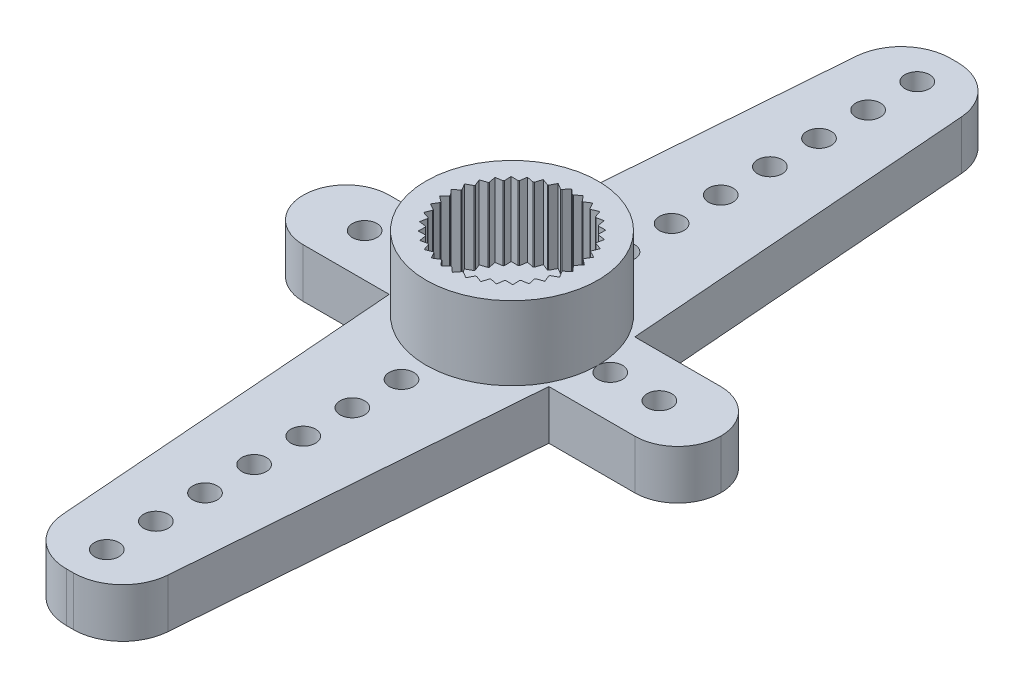
from build123d import *

# Parameters (mm, degrees)
BOSS_EXTRUDE1_DEPTH     = 2
FILLET1_R               = 2
FILLET2_R               = 1.75
SKETCH2_R               = 3.5
BOSS_EXTRUDE2_DEPTH     = 3
SKETCH3_R               = 2.5
CUT_EXTRUDE1_DEPTH      = 1
SKETCH4_R               = 1
CUT_EXTRUDE2_DEPTH      = 21.303940504
CUT_EXTRUDE3_START      = -3
SKETCH5_R               = 2.5
CUT_EXTRUDE3_DEPTH      = 3
CUT_EXTRUDE4_DEPTH      = 3
CIRPATTERN1_COUNT       = 36
SKETCH9_R               = 0.5
CUT_EXTRUDE5_DEPTH      = 21.524375752
LPATTERN1_COUNT         = 7
LPATTERN1_PITCH         = 2
MIRROR1_COPY_1_SKETCH_R = 0.5
MIRROR1_COPY_1_DEPTH    = 21.524375752
MIRROR1_COPY_2_SKETCH_R = 0.5
MIRROR1_COPY_2_DEPTH    = 21.524375752
MIRROR1_COPY_3_SKETCH_R = 0.5
MIRROR1_COPY_3_DEPTH    = 21.524375752
MIRROR1_COPY_4_SKETCH_R = 0.5
MIRROR1_COPY_4_DEPTH    = 21.524375752
MIRROR1_COPY_5_SKETCH_R = 0.5
MIRROR1_COPY_5_DEPTH    = 21.524375752
MIRROR1_COPY_6_SKETCH_R = 0.5
MIRROR1_COPY_6_DEPTH    = 21.524375752
SKETCH11_R              = 0.5
CUT_EXTRUDE6_DEPTH      = 21.524375752
LPATTERN2_COUNT         = 2
LPATTERN2_PITCH         = 2
MIRROR2_COPY_1_SKETCH_R = 0.5
MIRROR2_COPY_1_DEPTH    = 21.524375752


with BuildPart() as part:
    # Sketch1 → Boss-Extrude1 (new body)
    with BuildSketch(Plane(origin=(0, 0, 0), x_dir=(1, 0, 0), z_dir=(0, 1, 0))):
        Polygon((-8.5, 1.75), (-3.25, 1.75), (-2, 18), (2, 18), (3.25, 1.75), (8.5, 1.75), (8.5, -1.75), (3.25, -1.75), (2, -18), (-2, -18), (-3.25, -1.75), (-8.5, -1.75), align=None)
    extrude(amount=BOSS_EXTRUDE1_DEPTH)

    # Fillet1
    fillet1_edges = [part.edges().sort_by_distance(p)[0] for p in [
        (-2, 1, -18),
        (2, 1, -18),
        (2, 1, 18),
        (-2, 1, 18),
    ]]
    fillet(fillet1_edges, radius=FILLET1_R)

    # Fillet2
    fillet2_edges = [part.edges().sort_by_distance(p)[0] for p in [
        (-8.5, 1, -1.75),
        (-8.5, 1, 1.75),
        (8.5, 1, -1.75),
        (8.5, 1, 1.75),
    ]]
    fillet(fillet2_edges, radius=FILLET2_R - 0.0001)  # a hair under: the kernel refuses the full size

    # Sketch2 → Boss-Extrude2 (add)
    with BuildSketch(Plane(origin=(0, 2, 0), x_dir=(1, 0, 0), z_dir=(0, 1, 0))):
        with Locations(Location((0, 0, 0), (0, 0, 90))):
            Circle(SKETCH2_R)
    extrude(amount=BOSS_EXTRUDE2_DEPTH)

    # Sketch3 → Cut-Extrude1 (cut)
    with BuildSketch(Plane(origin=(0, 0, 0), x_dir=(-1, 0, 0), z_dir=(0, -1, 0))):
        with Locations(Location((0, 0, 0), (0, 0, 90))):
            Circle(SKETCH3_R)
    extrude(amount=-CUT_EXTRUDE1_DEPTH, mode=Mode.SUBTRACT)

    # Sketch4 → Cut-Extrude2 (cut, through all)
    with BuildSketch(Plane(origin=(0, 1, 0), x_dir=(-1, 0, 0), z_dir=(0, -1, 0))):
        with Locations(Location((0, 0, 0), (0, 0, 90))):
            Circle(SKETCH4_R)
    extrude(amount=-CUT_EXTRUDE2_DEPTH, mode=Mode.SUBTRACT)

    # Sketch5 → Cut-Extrude3 (cut)
    with BuildSketch(Plane(origin=(0, 5, 0), x_dir=(1, 0, 0), z_dir=(0, 1, 0)).offset(CUT_EXTRUDE3_START)):
        with Locations(Location((0, 0, 0), (0, 0, 90))):
            Circle(SKETCH5_R)
    extrude(amount=CUT_EXTRUDE3_DEPTH, mode=Mode.SUBTRACT)

    # Sketch6 → Cut-Extrude4 (cut)
    with BuildSketch(Plane(origin=(0, 5, 0), x_dir=(1, 0, 0), z_dir=(0, 1, 0))):
        Polygon((-2.5, 0), (-2.691676801, 0.211839558), (-2.469220851, 0.391086163), align=None)
    cut_extrude4 = extrude(amount=-CUT_EXTRUDE4_DEPTH, mode=Mode.SUBTRACT)

    # CirPattern1: Cut-Extrude4 ×36 about axis
    cirpattern1_axis = Axis((0, 0, 0), (0, 1, 0))
    for i in range(1, CIRPATTERN1_COUNT):
        add(cut_extrude4.rotate(cirpattern1_axis, i * 360 / CIRPATTERN1_COUNT), mode=Mode.SUBTRACT)

    # Sketch9 → Cut-Extrude5 (cut, through all)
    with BuildSketch(Plane(origin=(0, 0, 0), x_dir=(-1, 0, 0), z_dir=(0, -1, 0))):
        with Locations(Location((0, 16.5, 0), (0, 0, 90))):
            Circle(SKETCH9_R)
    cut_extrude5 = extrude(amount=-CUT_EXTRUDE5_DEPTH, mode=Mode.SUBTRACT)

    # LPattern1: Cut-Extrude5 ×7
    with Locations(*[(0, 0, i * LPATTERN1_PITCH) for i in range(1, LPATTERN1_COUNT)]):
        add(cut_extrude5, mode=Mode.SUBTRACT)

    # Mirror1: Cut-Extrude5 across plane
    add(cut_extrude5.mirror(Plane.XY), mode=Mode.SUBTRACT)

    # Mirror1 copy 1 sketch → Mirror1 copy 1 (cut, through all)
    with BuildSketch(Plane(origin=(0, 0, -2), x_dir=(-1, 0, 0), z_dir=(0, -1, 0))):
        with Locations((0, -16.5)):
            Circle(MIRROR1_COPY_1_SKETCH_R)
    extrude(amount=-MIRROR1_COPY_1_DEPTH, mode=Mode.SUBTRACT)

    # Mirror1 copy 2 sketch → Mirror1 copy 2 (cut, through all)
    with BuildSketch(Plane(origin=(0, 0, -4), x_dir=(-1, 0, 0), z_dir=(0, -1, 0))):
        with Locations((0, -16.5)):
            Circle(MIRROR1_COPY_2_SKETCH_R)
    extrude(amount=-MIRROR1_COPY_2_DEPTH, mode=Mode.SUBTRACT)

    # Mirror1 copy 3 sketch → Mirror1 copy 3 (cut, through all)
    with BuildSketch(Plane(origin=(0, 0, -6), x_dir=(-1, 0, 0), z_dir=(0, -1, 0))):
        with Locations((0, -16.5)):
            Circle(MIRROR1_COPY_3_SKETCH_R)
    extrude(amount=-MIRROR1_COPY_3_DEPTH, mode=Mode.SUBTRACT)

    # Mirror1 copy 4 sketch → Mirror1 copy 4 (cut, through all)
    with BuildSketch(Plane(origin=(0, 0, -8), x_dir=(-1, 0, 0), z_dir=(0, -1, 0))):
        with Locations((0, -16.5)):
            Circle(MIRROR1_COPY_4_SKETCH_R)
    extrude(amount=-MIRROR1_COPY_4_DEPTH, mode=Mode.SUBTRACT)

    # Mirror1 copy 5 sketch → Mirror1 copy 5 (cut, through all)
    with BuildSketch(Plane(origin=(0, 0, -10), x_dir=(-1, 0, 0), z_dir=(0, -1, 0))):
        with Locations((0, -16.5)):
            Circle(MIRROR1_COPY_5_SKETCH_R)
    extrude(amount=-MIRROR1_COPY_5_DEPTH, mode=Mode.SUBTRACT)

    # Mirror1 copy 6 sketch → Mirror1 copy 6 (cut, through all)
    with BuildSketch(Plane(origin=(0, 0, -12), x_dir=(-1, 0, 0), z_dir=(0, -1, 0))):
        with Locations((0, -16.5)):
            Circle(MIRROR1_COPY_6_SKETCH_R)
    extrude(amount=-MIRROR1_COPY_6_DEPTH, mode=Mode.SUBTRACT)

    # Sketch11 → Cut-Extrude6 (cut, through all)
    with BuildSketch(Plane(origin=(0, 0, 0), x_dir=(-1, 0, 0), z_dir=(0, -1, 0))):
        with Locations(Location((-6, 0, 0), (0, 0, 90))):
            Circle(SKETCH11_R)
    cut_extrude6 = extrude(amount=-CUT_EXTRUDE6_DEPTH, mode=Mode.SUBTRACT)

    # LPattern2: Cut-Extrude6 ×2
    with Locations(*[(-i * LPATTERN2_PITCH, 0, 0) for i in range(1, LPATTERN2_COUNT)]):
        add(cut_extrude6, mode=Mode.SUBTRACT)

    # Mirror2: Cut-Extrude6 across plane
    add(cut_extrude6.mirror(Plane(origin=(0, 0, 0), x_dir=(0, 0, 1), z_dir=(1, 0, 0))), mode=Mode.SUBTRACT)

    # Mirror2 copy 1 sketch → Mirror2 copy 1 (cut, through all)
    with BuildSketch(Plane(origin=(2, 0, 0), x_dir=(1, 0, 0), z_dir=(0, -1, 0))):
        with Locations((-6, 0)):
            Circle(MIRROR2_COPY_1_SKETCH_R)
    extrude(amount=-MIRROR2_COPY_1_DEPTH, mode=Mode.SUBTRACT)


solid = part.part
